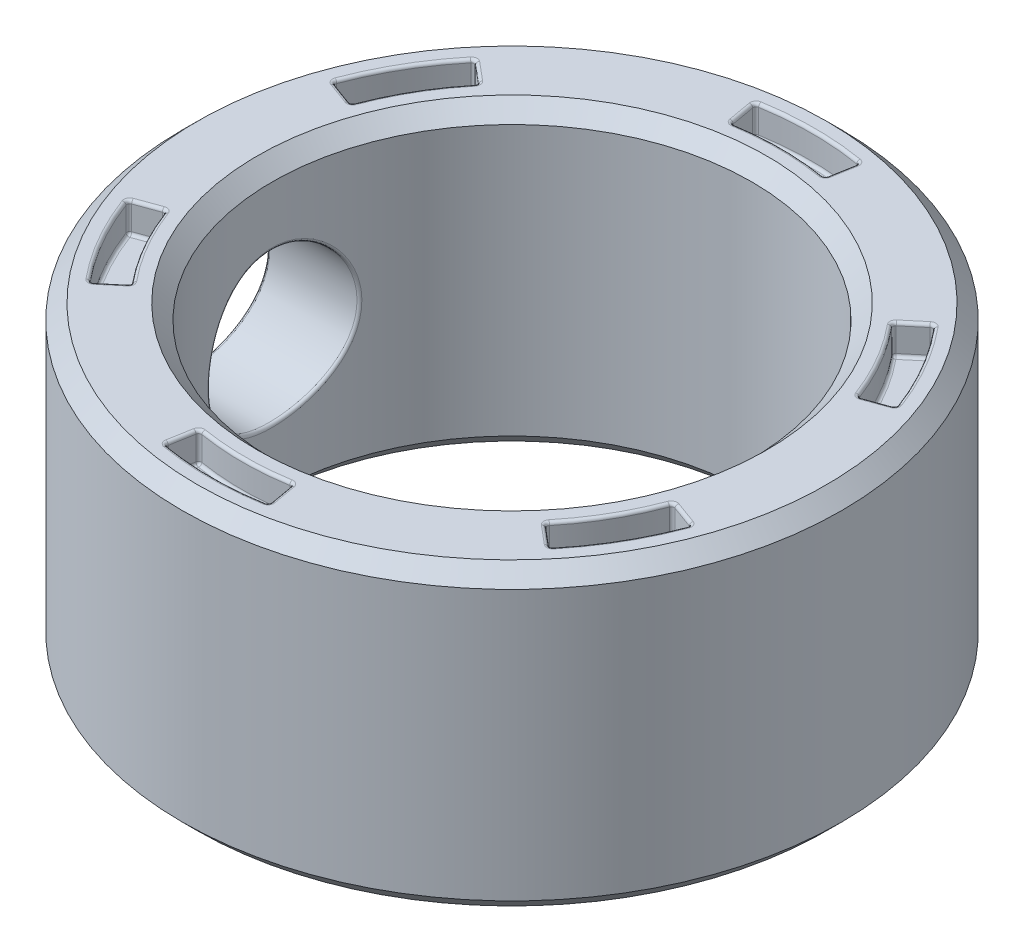
from build123d import *

# Parameters (mm, degrees)
SKETCH1_R                = 11
SKETCH1_R_2              = 8
BOSS_EXTRUDE1_DEPTH      = 10
CHAMFER1_SIZE            = 0.5
CUT_EXTRUDE1_DEPTH       = 1
FILLET1_R                = 0.1
CIRPATTERN1_COUNT        = 6
FILLET1_OF_CIRPATTERN1_R = 0.1
CUT_EXTRUDE2_REACH       = 20.493
SKETCH3_R                = 2.5
FILLET2_R                = 0.1


with BuildPart() as part:
    # Sketch1 → Boss-Extrude1 (new body)
    with BuildSketch(Plane(origin=(0, 0, 0), x_dir=(1, 0, 0), z_dir=(0, 1, 0))):
        Circle(SKETCH1_R)
        Circle(SKETCH1_R_2, mode=Mode.SUBTRACT)
    extrude(amount=BOSS_EXTRUDE1_DEPTH)

    # Chamfer1
    chamfer1_edges = [part.edges().sort_by_distance(p)[0] for p in [
        (-8, 0, 0),
        (-11, 0, 0),
        (-11, 10, 0),
        (-8, 10, 0),
    ]]
    chamfer(chamfer1_edges, length=CHAMFER1_SIZE)

    # Sketch2 → Cut-Extrude1 (cut)
    with BuildSketch(Plane(origin=(0, 10, 0), x_dir=(1, 0, 0), z_dir=(0, 1, 0))):
        with BuildLine():
            Line((-1.736481777, 9.84807753), (-1.562833599, 8.863269777))
            ThreePointArc((-1.562833599, 8.863269777), (0, 9), (1.562833599, 8.863269777))
            Line((1.562833599, 8.863269777), (1.736481777, 9.84807753))
            ThreePointArc((1.736481777, 9.84807753), (0, 10), (-1.736481777, 9.84807753))
        make_face()
    cut_extrude1 = extrude(amount=-CUT_EXTRUDE1_DEPTH, mode=Mode.SUBTRACT)

    # Fillet1
    fillet1_edges = [part.edges().sort_by_distance(p)[0] for p in [
        (1.736481777, 9.5, -9.84807753),
        (1.562833599, 9.5, -8.863269777),
        (1.649657688, 10, -9.355673654),
        (1.649657688, 9, -9.355673654),
        (-1.562833599, 9.5, -8.863269777),
        (-1.736481777, 9.5, -9.84807753),
        (-1.649657688, 10, -9.355673654),
        (-1.649657688, 9, -9.355673654),
        (0, 10, -10),
        (0, 9, -10),
        (0, 10, -9),
        (0, 9, -9),
    ]]
    fillet(fillet1_edges, radius=FILLET1_R)

    # CirPattern1: Cut-Extrude1 ×6 about axis
    cirpattern1_axis = Axis((0, 10, 0), (0, -1, 0))
    for i in range(1, CIRPATTERN1_COUNT):
        add(cut_extrude1.rotate(cirpattern1_axis, i * 360 / CIRPATTERN1_COUNT), mode=Mode.SUBTRACT)

    # Fillet1 of CirPattern1
    fillet1_of_cirpattern1_edges = [part.edges().sort_by_distance(p)[0] for p in [
        (9.396926208, 9.5, -3.420201433),
        (8.457233587, 9.5, -3.07818129),
        (8.927079897, 10, -3.249191362),
        (8.927079897, 9, -3.249191362),
        (6.894399988, 9.5, -5.785088487),
        (7.660444431, 9.5, -6.427876097),
        (7.27742221, 10, -6.106482292),
        (7.27742221, 9, -6.106482292),
        (8.660254038, 10, -5),
        (8.660254038, 9, -5),
        (7.794228634, 10, -4.5),
        (7.794228634, 9, -4.5),
        (7.660444431, 9.5, 6.427876097),
        (6.894399988, 9.5, 5.785088487),
        (7.27742221, 10, 6.106482292),
        (7.27742221, 9, 6.106482292),
        (8.457233587, 9.5, 3.07818129),
        (9.396926208, 9.5, 3.420201433),
        (8.927079897, 10, 3.249191362),
        (8.927079897, 9, 3.249191362),
        (8.660254038, 10, 5),
        (8.660254038, 9, 5),
        (7.794228634, 10, 4.5),
        (7.794228634, 9, 4.5),
        (-1.736481777, 9.5, 9.84807753),
        (-1.562833599, 9.5, 8.863269777),
        (-1.649657688, 10, 9.355673654),
        (-1.649657688, 9, 9.355673654),
        (1.562833599, 9.5, 8.863269777),
        (1.736481777, 9.5, 9.84807753),
        (1.649657688, 10, 9.355673654),
        (1.649657688, 9, 9.355673654),
        (0, 10, 10),
        (0, 9, 10),
        (0, 10, 9),
        (0, 9, 9),
        (-9.396926208, 9.5, 3.420201433),
        (-8.457233587, 9.5, 3.07818129),
        (-8.927079897, 10, 3.249191362),
        (-8.927079897, 9, 3.249191362),
        (-6.894399988, 9.5, 5.785088487),
        (-7.660444431, 9.5, 6.427876097),
        (-7.27742221, 10, 6.106482292),
        (-7.27742221, 9, 6.106482292),
        (-8.660254038, 10, 5),
        (-8.660254038, 9, 5),
        (-7.794228634, 10, 4.5),
        (-7.794228634, 9, 4.5),
        (-7.660444431, 9.5, -6.427876097),
        (-6.894399988, 9.5, -5.785088487),
        (-7.27742221, 10, -6.106482292),
        (-7.27742221, 9, -6.106482292),
        (-8.457233587, 9.5, -3.07818129),
        (-9.396926208, 9.5, -3.420201433),
        (-8.927079897, 10, -3.249191362),
        (-8.927079897, 9, -3.249191362),
        (-8.660254038, 10, -5),
        (-8.660254038, 9, -5),
        (-7.794228634, 10, -4.5),
        (-7.794228634, 9, -4.5),
    ]]
    fillet(fillet1_of_cirpattern1_edges, radius=FILLET1_OF_CIRPATTERN1_R)

    # Sketch3 → Cut-Extrude2 (cut, up to next)
    with BuildSketch(Plane(origin=(0, 0, 0), x_dir=(0, 0, -1), z_dir=(1, 0, 0)), mode=Mode.PRIVATE) as cut_extrude2_sk1:
        with Locations((0, 5)):
            Circle(SKETCH3_R)
    cut_extrude2_tool1 = extrude(cut_extrude2_sk1.sketch, amount=-CUT_EXTRUDE2_REACH, mode=Mode.PRIVATE) & part.part
    add(cut_extrude2_tool1.solids().sort_by_distance((0, 5, 0))[0], mode=Mode.SUBTRACT)

    # Fillet2
    fillet2_edges = [part.edges().sort_by_distance(p)[0] for p in [
        (-7.599342077, 5, 2.5),
        (-10.712142643, 5, 2.5),
    ]]
    fillet(fillet2_edges, radius=FILLET2_R)


solid = part.part
